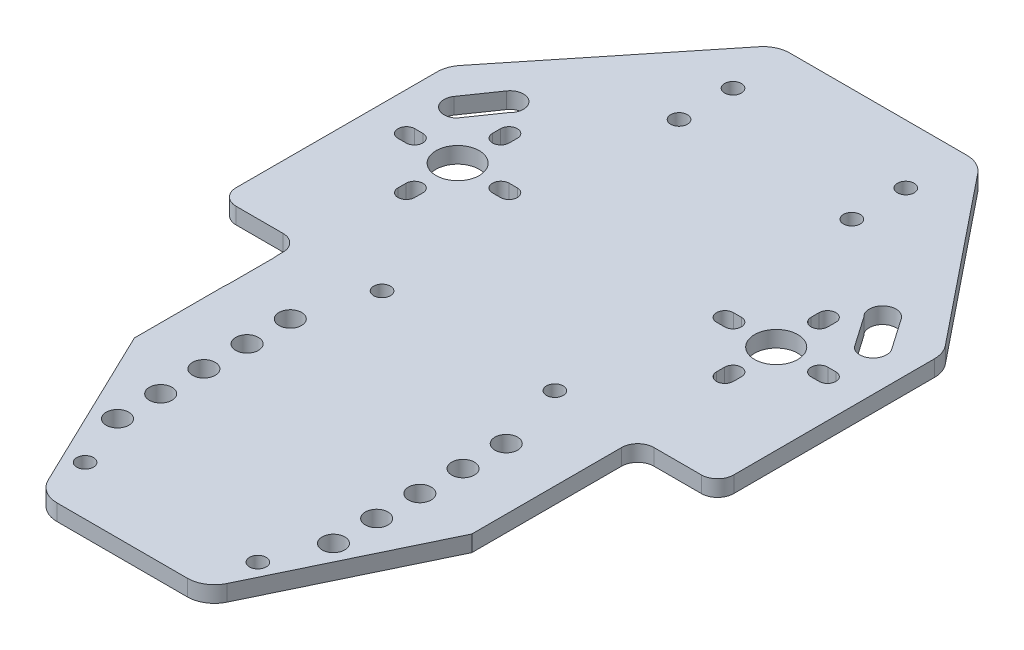
from build123d import *

# Parameters (mm, degrees)
SKETCH1_2_R         = 1.55
SKETCH1_2_R_2       = 2.1
SKETCH1_2_R_3       = 4
EXTRUDE_1_DEPTH     = 3
CUT_EXTRUDE_1_DEPTH = 103.641715784
FILLET_1_R          = 5
FILLET_2_R          = 3


with BuildPart() as part:
    # Sketch1<2> → 凸台-拉伸1 (new body)
    with BuildSketch(Plane(origin=(0, 0, 0), x_dir=(1, 0, 0), z_dir=(0, 1, 0))):
        Polygon((46.148756691, -91.633040301), (46, 48.415898807), (-46, 48.415898807), (-46.148704625, -91.584022218), align=None)
        with Locations((-16, -82.5)):
            Circle(SKETCH1_2_R, mode=Mode.SUBTRACT)
        with Locations((-20, -72.5)):
            Circle(SKETCH1_2_R_2, mode=Mode.SUBTRACT)
        with Locations((-20, -64.5)):
            Circle(SKETCH1_2_R_2, mode=Mode.SUBTRACT)
        with BuildLine():
            Line((-31.324560396, -32.437502342), (-31.324560396, -40.532123219))
            ThreePointArc((-31.324560396, -40.532123219), (-34.902584515, -44.110147338), (-38.480608633, -40.532123219))
            Line((-38.480608633, -40.532123219), (-38.480608633, -33.618273202))
            ThreePointArc((-38.480608633, -33.618273202), (-35.598368392, -28.811097573), (-31.324560396, -32.437502342))
        make_face(mode=Mode.SUBTRACT)
        with Locations((-20, -56.5)):
            Circle(SKETCH1_2_R_2, mode=Mode.SUBTRACT)
        with Locations((-20, -48.5)):
            Circle(SKETCH1_2_R_2, mode=Mode.SUBTRACT)
        with Locations((-20, -40.5)):
            Circle(SKETCH1_2_R_2, mode=Mode.SUBTRACT)
        with Locations((-16, -27.5)):
            Circle(SKETCH1_2_R, mode=Mode.SUBTRACT)
        with Locations((16, -82.5)):
            Circle(SKETCH1_2_R, mode=Mode.SUBTRACT)
        with Locations((20, -72.5)):
            Circle(SKETCH1_2_R_2, mode=Mode.SUBTRACT)
        with Locations((20, -64.5)):
            Circle(SKETCH1_2_R_2, mode=Mode.SUBTRACT)
        with Locations((20, -56.5)):
            Circle(SKETCH1_2_R_2, mode=Mode.SUBTRACT)
        with Locations((20, -48.5)):
            Circle(SKETCH1_2_R_2, mode=Mode.SUBTRACT)
        with Locations((20, -40.5)):
            Circle(SKETCH1_2_R_2, mode=Mode.SUBTRACT)
        with Locations((16, -27.5)):
            Circle(SKETCH1_2_R, mode=Mode.SUBTRACT)
        with BuildLine():
            ThreePointArc((38.480608633, -40.532123219), (34.902584515, -44.110147338), (31.324560396, -40.532123219))
            Line((31.324560396, -40.532123219), (31.324560396, -32.437502342))
            ThreePointArc((31.324560396, -32.437502342), (35.598368392, -28.811097573), (38.480608633, -33.618273202))
            Line((38.480608633, -33.618273202), (38.480608633, -40.532123219))
        make_face(mode=Mode.SUBTRACT)
        with BuildLine():
            Line((-31.05, -9.5), (-31.05, -8))
            ThreePointArc((-31.05, -8), (-29.5, -6.45), (-27.95, -8))
            Line((-27.95, -8), (-27.95, -9.5))
            ThreePointArc((-27.95, -9.5), (-29.5, -11.05), (-31.05, -9.5))
        make_face(mode=Mode.SUBTRACT)
        with BuildLine():
            Line((-39, 1.55), (-37.5, 1.55))
            ThreePointArc((-37.5, 1.55), (-35.95, 0), (-37.5, -1.55))
            Line((-37.5, -1.55), (-39, -1.55))
            ThreePointArc((-39, -1.55), (-40.55, 0), (-39, 1.55))
        make_face(mode=Mode.SUBTRACT)
        with BuildLine():
            Line((-32.838354936, 12.874839613), (-36.826644357, 7.122140465))
            ThreePointArc((-36.826644357, 7.122140465), (-40.125878325, 7.09368849), (-40.5284969, 10.368387343))
            Line((-40.5284969, 10.368387343), (-36.540207479, 16.121086492))
            ThreePointArc((-36.540207479, 16.121086492), (-32.870241162, 16.57230252), (-32.838354936, 12.874839613))
        make_face(mode=Mode.SUBTRACT)
        with Locations((-29.5, 0)):
            Circle(SKETCH1_2_R_3, mode=Mode.SUBTRACT)
        with BuildLine():
            Line((-27.95, 9.5), (-27.95, 8))
            ThreePointArc((-27.95, 8), (-29.5, 6.45), (-31.05, 8))
            Line((-31.05, 8), (-31.05, 9.5))
            ThreePointArc((-31.05, 9.5), (-29.5, 11.05), (-27.95, 9.5))
        make_face(mode=Mode.SUBTRACT)
        with BuildLine():
            Line((-20, -1.55), (-21.5, -1.55))
            ThreePointArc((-21.5, -1.55), (-23.05, 0), (-21.5, 1.55))
            Line((-21.5, 1.55), (-20, 1.55))
            ThreePointArc((-20, 1.55), (-18.45, 0), (-20, -1.55))
        make_face(mode=Mode.SUBTRACT)
        with Locations((-16, 27.5)):
            Circle(SKETCH1_2_R, mode=Mode.SUBTRACT)
        with Locations((-16, 37.5)):
            Circle(SKETCH1_2_R, mode=Mode.SUBTRACT)
        with BuildLine():
            ThreePointArc((21.5, 1.55), (23.05, 0), (21.5, -1.55))
            Line((21.5, -1.55), (20, -1.55))
            ThreePointArc((20, -1.55), (18.45, 0), (20, 1.55))
            Line((20, 1.55), (21.5, 1.55))
        make_face(mode=Mode.SUBTRACT)
        with BuildLine():
            ThreePointArc((27.95, -8), (29.5, -6.45), (31.05, -8))
            Line((31.05, -8), (31.05, -9.5))
            ThreePointArc((31.05, -9.5), (29.5, -11.05), (27.95, -9.5))
            Line((27.95, -9.5), (27.95, -8))
        make_face(mode=Mode.SUBTRACT)
        with Locations((29.5, 0)):
            Circle(SKETCH1_2_R_3, mode=Mode.SUBTRACT)
        with BuildLine():
            ThreePointArc((31.05, 8), (29.5, 6.45), (27.95, 8))
            Line((27.95, 8), (27.95, 9.5))
            ThreePointArc((27.95, 9.5), (29.5, 11.05), (31.05, 9.5))
            Line((31.05, 9.5), (31.05, 8))
        make_face(mode=Mode.SUBTRACT)
        with BuildLine():
            ThreePointArc((37.5, -1.55), (35.95, 0), (37.5, 1.55))
            Line((37.5, 1.55), (39, 1.55))
            ThreePointArc((39, 1.55), (40.55, 0), (39, -1.55))
            Line((39, -1.55), (37.5, -1.55))
        make_face(mode=Mode.SUBTRACT)
        with BuildLine():
            ThreePointArc((40.5284969, 10.368387343), (40.125878325, 7.09368849), (36.826644357, 7.122140465))
            Line((36.826644357, 7.122140465), (32.838354936, 12.874839613))
            ThreePointArc((32.838354936, 12.874839613), (32.870241162, 16.57230252), (36.540207479, 16.121086492))
            Line((36.540207479, 16.121086492), (40.5284969, 10.368387343))
        make_face(mode=Mode.SUBTRACT)
        with Locations((16, 27.5)):
            Circle(SKETCH1_2_R, mode=Mode.SUBTRACT)
        with Locations((16, 37.5)):
            Circle(SKETCH1_2_R, mode=Mode.SUBTRACT)
    extrude(amount=EXTRUDE_1_DEPTH)

    # 草图8 → 切除-拉伸1 (cut, through all)
    with BuildSketch(Plane(origin=(0, 0, 0), x_dir=(1, 0, 0), z_dir=(0, 1, 0))):
        Polygon((-60.581160188, -100.138876612), (-11.106907858, -100.138876612), (-31.388896544, -57.980337113), (-31.388896544, -27.441927357), (-46.0805744, -27.441927357), (-60.581160188, 2.69927468), align=None)
        Polygon((11.106907858, -100.138876612), (60.581160188, -100.138876612), (60.581160188, 2.69927468), (46.0805744, -27.441927357), (31.297190757, -27.441927357), (31.297190757, -58.170958562), align=None)
        Polygon((-55.547798239, 53.825279921), (-55.547798239, 2.686584408), (-14.43040337, 53.825279921), align=None)
        Polygon((55.547798239, 2.686584408), (55.547798239, 53.825279921), (14.43040337, 53.825279921), align=None)
    extrude(amount=CUT_EXTRUDE_1_DEPTH, mode=Mode.SUBTRACT)

    # 圆角1
    fillet_1_edges = [part.edges().sort_by_distance(p)[0] for p in [
        (-15.214646295, 1.5, 91.600450928),
        (15.206873585, 1.5, 91.616607436),
        (46.036007008, 1.5, -14.516628531),
        (18.779745038, 1.5, -48.415898807),
        (-18.779745038, 1.5, -48.415898807),
        (-46.036007008, 1.5, -14.516628531),
    ]]
    fillet(fillet_1_edges, radius=FILLET_1_R)

    # 圆角2
    fillet_2_edges = [part.edges().sort_by_distance(p)[0] for p in [
        (-46.0805744, 1.5, 27.441927357),
        (-31.388896544, 1.5, 27.441927357),
        (31.297190757, 1.5, 27.441927357),
        (46.0805744, 1.5, 27.441927357),
    ]]
    fillet(fillet_2_edges, radius=FILLET_2_R)


solid = part.part
